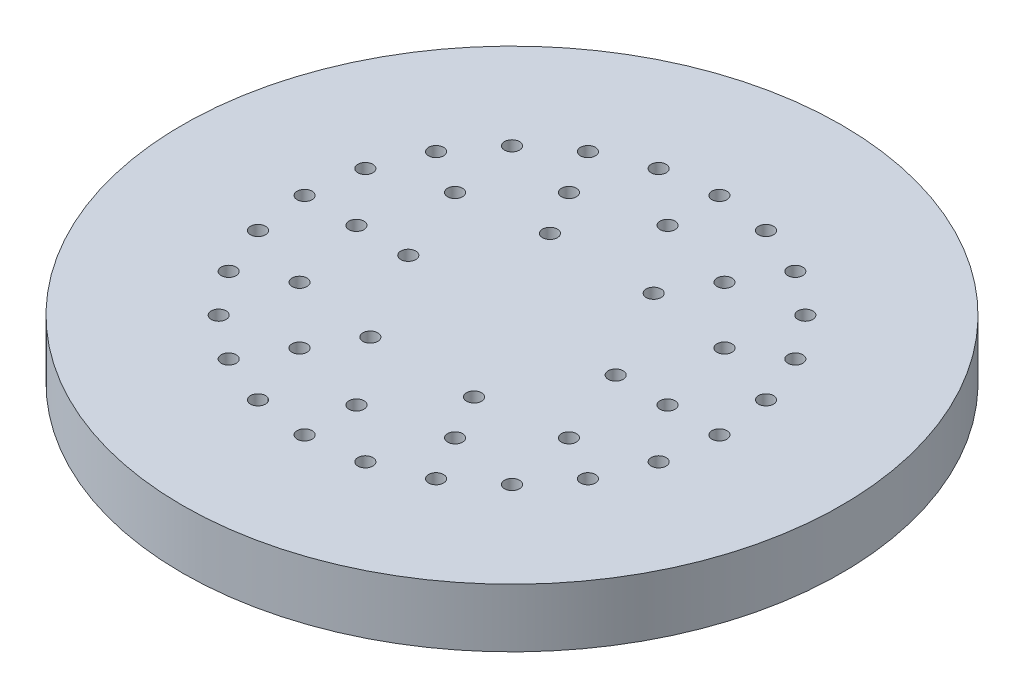
from build123d import *

# Parameters (mm, degrees)
SKETCH1_R             = 28.575
BILLET_DEPTH          = 5.08
SKETCH2_R             = 0.6477
FIRST_LOX_HOLE_DEPTH  = 41.729198985
CIRPATTERN1_COUNT     = 6
CIRPATTERN2_START     = -5.08
CIRPATTERN2_OUTLINE_R = 0.6477
CIRPATTERN2_DEPTH     = 5.08
CIRPATTERN3_START     = -5.08
CIRPATTERN3_OUTLINE_R = 0.6477
CIRPATTERN3_DEPTH     = 5.08
SKETCH4_R             = 1.190625
DOWEL_DEPTH           = 3.175


# Read off the part's stored shape, not the designer's step: CirPattern2, CirPattern3
with BuildPart() as part:
    # Sketch1 → Billet (new body)
    with BuildSketch(Plane(origin=(0, 0, 0), x_dir=(1, 0, 0), z_dir=(0, 1, 0))):
        with Locations(Location((0, 0, 0), (0, 0, 270))):
            Circle(SKETCH1_R)
    extrude(amount=-BILLET_DEPTH)

    # Sketch2 → First Lox Hole (cut, through all)
    with BuildSketch(Plane(origin=(0, 0, 0), x_dir=(1, 0, 0), z_dir=(0, 1, 0))):
        with Locations(Location((8.9916, 0, 0), (0, 0, 270))):
            Circle(SKETCH2_R)
        with Locations(Location((13.4874, 0, 0), (0, 0, 270))):
            Circle(SKETCH2_R)
        with Locations(Location((17.9832, 0, 0), (0, 0, 270))):
            Circle(SKETCH2_R)
    first_lox_hole = extrude(amount=-FIRST_LOX_HOLE_DEPTH, mode=Mode.SUBTRACT)

    # CirPattern1: First Lox Hole ×6 about axis
    cirpattern1_axis = Axis((0, 0, 0), (0, 1, 0))
    for i in range(1, CIRPATTERN1_COUNT):
        add(first_lox_hole.rotate(cirpattern1_axis, i * 360 / CIRPATTERN1_COUNT), mode=Mode.SUBTRACT)

    # CirPattern2 outline → CirPattern2 (cut)
    with BuildSketch(Plane(origin=(0, 0, 0), x_dir=(1, 0, 0), z_dir=(0, 1, 0)).offset(CIRPATTERN2_START)):
        with Locations((11.680431031, -6.7437)):
            Circle(CIRPATTERN2_OUTLINE_R)
        with Locations((0, -13.4874)):
            Circle(CIRPATTERN2_OUTLINE_R)
        with Locations((-11.680431031, -6.7437)):
            Circle(CIRPATTERN2_OUTLINE_R)
        with Locations((-11.680431031, 6.7437)):
            Circle(CIRPATTERN2_OUTLINE_R)
        with Locations((0, 13.4874)):
            Circle(CIRPATTERN2_OUTLINE_R)
        with Locations((11.680431031, 6.7437)):
            Circle(CIRPATTERN2_OUTLINE_R)
    extrude(amount=CIRPATTERN2_DEPTH, mode=Mode.SUBTRACT)

    # CirPattern3 outline → CirPattern3 (cut)
    with BuildSketch(Plane(origin=(0, 0, 0), x_dir=(1, 0, 0), z_dir=(0, 1, 0)).offset(CIRPATTERN3_START)):
        with Locations((17.370437319, -4.654394652)):
            Circle(CIRPATTERN3_OUTLINE_R)
        with Locations((15.573908041, -8.9916)):
            Circle(CIRPATTERN3_OUTLINE_R)
        with Locations((12.716042667, -12.716042667)):
            Circle(CIRPATTERN3_OUTLINE_R)
        with Locations((4.654394652, -17.370437319)):
            Circle(CIRPATTERN3_OUTLINE_R)
        with Locations((0, -17.9832)):
            Circle(CIRPATTERN3_OUTLINE_R)
        with Locations((-4.654394652, -17.370437319)):
            Circle(CIRPATTERN3_OUTLINE_R)
        with Locations((-12.716042667, -12.716042667)):
            Circle(CIRPATTERN3_OUTLINE_R)
        with Locations((-15.573908041, -8.9916)):
            Circle(CIRPATTERN3_OUTLINE_R)
        with Locations((-17.370437319, -4.654394652)):
            Circle(CIRPATTERN3_OUTLINE_R)
        with Locations((-17.370437319, 4.654394652)):
            Circle(CIRPATTERN3_OUTLINE_R)
        with Locations((-15.573908041, 8.9916)):
            Circle(CIRPATTERN3_OUTLINE_R)
        with Locations((-12.716042667, 12.716042667)):
            Circle(CIRPATTERN3_OUTLINE_R)
        with Locations((-4.654394652, 17.370437319)):
            Circle(CIRPATTERN3_OUTLINE_R)
        with Locations((0, 17.9832)):
            Circle(CIRPATTERN3_OUTLINE_R)
        with Locations((4.654394652, 17.370437319)):
            Circle(CIRPATTERN3_OUTLINE_R)
        with Locations((12.716042667, 12.716042667)):
            Circle(CIRPATTERN3_OUTLINE_R)
        with Locations((15.573908041, 8.9916)):
            Circle(CIRPATTERN3_OUTLINE_R)
        with Locations((17.370437319, 4.654394652)):
            Circle(CIRPATTERN3_OUTLINE_R)
    extrude(amount=CIRPATTERN3_DEPTH, mode=Mode.SUBTRACT)

    # Sketch4 → Dowel (cut)
    with BuildSketch(Plane(origin=(0, -5.08, 0), x_dir=(1, 0, 0), z_dir=(0, 1, 0))):
        with Locations(Location((0, 25.4, 0), (0, 0, 270))):
            Circle(SKETCH4_R)
        with Locations(Location((0, -25.4, 0), (0, 0, 90))):
            Circle(SKETCH4_R)
    extrude(amount=DOWEL_DEPTH, mode=Mode.SUBTRACT)


solid = part.part
